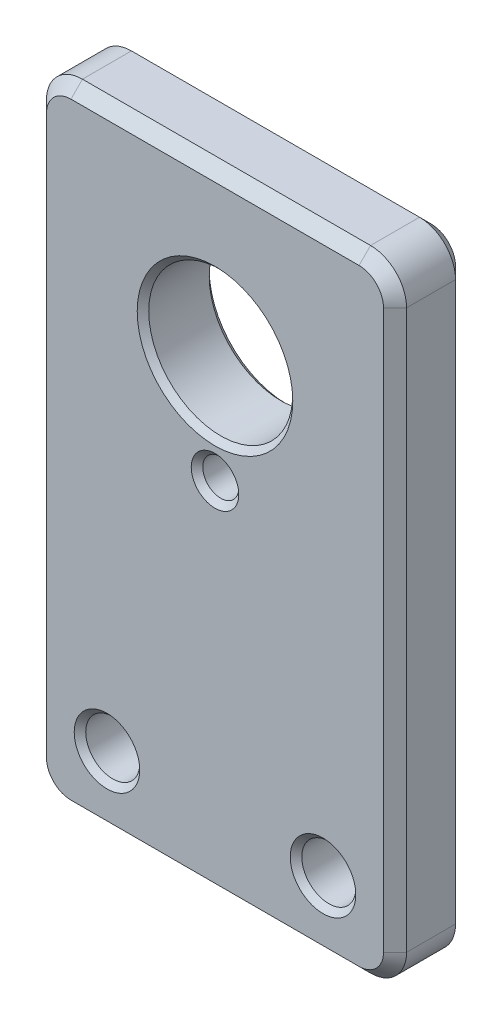
from build123d import *

# Parameters (mm, degrees)
SKETCH1_W                       = 15.875
SKETCH1_H                       = 27.78125
BOSS_EXTRUDE1_DEPTH             = 1.5875
F_3_32_0_09375_DIAMETER_HOLE1_D = 2.38125
F_1_4_0_25_DIAMETER_HOLE1_D     = 6.35
F_1_16_0_0625_DIAMETER_HOLE1_D  = 1.5875
FILLET1_R                       = 1.5875
CHAMFER1_SIZE                   = 0.508
CHAMFER2_SIZE                   = 0.254


with BuildPart() as part:
    # Sketch1 → Boss-Extrude1 (new, symmetric)
    with BuildSketch(Plane.XY):
        Rectangle(SKETCH1_W, SKETCH1_H)
    extrude(amount=BOSS_EXTRUDE1_DEPTH, both=True)

    # 3/32 (0.09375) Diameter Hole1 (through all)
    with Locations(Plane.XY.offset(1.5875)):
        with Locations((-4.7625, -10.715625), (4.7625, -10.715625)):
            Hole(F_3_32_0_09375_DIAMETER_HOLE1_D / 2)

    # 1/4 (0.25) Diameter Hole1 (through all)
    with Locations(Plane.XY.offset(1.5875)):
        with Locations((0, 6.746875)):
            Hole(F_1_4_0_25_DIAMETER_HOLE1_D / 2)

    # 1/16 (0.0625) Diameter Hole1 (through all)
    with Locations(Plane.XY.offset(1.5875)):
        with Locations((0, 1.984375)):
            Hole(F_1_16_0_0625_DIAMETER_HOLE1_D / 2)

    # Fillet1
    fillet1_edges = [part.edges().sort_by_distance(p)[0] for p in [
        (7.9375, -13.890625, 0),
        (-7.9375, -13.890625, 0),
        (-7.9375, 13.890625, 0),
        (7.9375, 13.890625, 0),
    ]]
    fillet(fillet1_edges, radius=FILLET1_R)

    # Chamfer1
    chamfer1_edges = [part.edges().sort_by_distance(p)[0] for p in [
        (7.472532015, 13.425657015, -1.5875),
        (0, 13.890625, -1.5875),
        (-7.472532015, 13.425657015, -1.5875),
        (-7.9375, 0, -1.5875),
        (-7.472532015, -13.425657015, -1.5875),
        (0, -13.890625, -1.5875),
        (7.472532015, -13.425657015, -1.5875),
        (7.9375, 0, -1.5875),
        (-7.472532015, -13.425657015, 1.5875),
        (-7.9375, 0, 1.5875),
        (-7.472532015, 13.425657015, 1.5875),
        (0, 13.890625, 1.5875),
        (7.472532015, 13.425657015, 1.5875),
        (7.9375, 0, 1.5875),
        (7.472532015, -13.425657015, 1.5875),
        (0, -13.890625, 1.5875),
    ]]
    chamfer(chamfer1_edges, length=CHAMFER1_SIZE)

    # Chamfer2
    chamfer2_edges = [part.edges().sort_by_distance(p)[0] for p in [
        (5.953125, -10.715625, 1.5875),
        (5.953125, -10.715625, -1.5875),
        (-3.571875, -10.715625, 1.5875),
        (-3.571875, -10.715625, -1.5875),
        (0.79375, 1.984375, 1.5875),
        (0.79375, 1.984375, -1.5875),
        (3.175, 6.746875, 1.5875),
        (3.175, 6.746875, -1.5875),
    ]]
    chamfer(chamfer2_edges, length=CHAMFER2_SIZE)


solid = part.part
